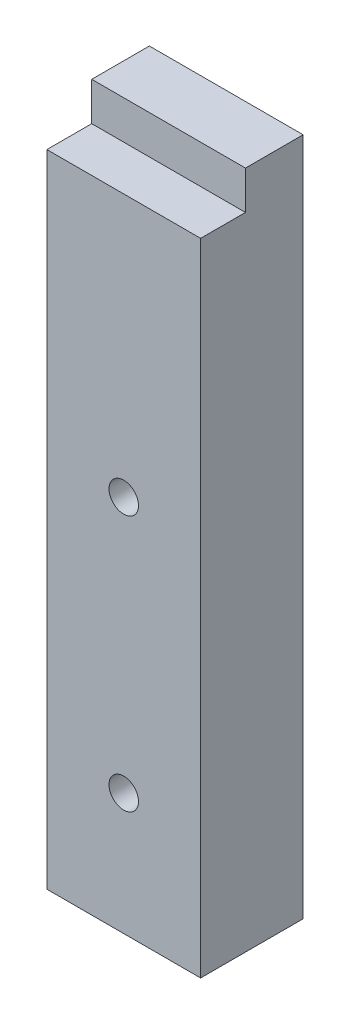
from build123d import *

# Parameters (mm, degrees)
SKETCH1_W           = 12
SKETCH1_H           = 50
SKETCH1_R           = 1.15
BOSS_EXTRUDE1_DEPTH = 8
SKETCH2_W           = 12
SKETCH2_H           = 4.5
BOSS_EXTRUDE2_DEPTH = 3


with BuildPart() as part:
    # Sketch1 → Boss-Extrude1 (new body)
    with BuildSketch(Plane.XY):
        with Locations((6, 25)):
            Rectangle(SKETCH1_W, SKETCH1_H)
        with Locations((6, 29.5)):
            Circle(SKETCH1_R, mode=Mode.SUBTRACT)
        with Locations((6, 9.5)):
            Circle(SKETCH1_R, mode=Mode.SUBTRACT)
    extrude(amount=BOSS_EXTRUDE1_DEPTH)

    # Sketch2 → Boss-Extrude2 (add)
    with BuildSketch(Plane(origin=(0, 50, 0), x_dir=(1, 0, 0), z_dir=(0, 1, 0))):
        with Locations((6, -2.25)):
            Rectangle(SKETCH2_W, SKETCH2_H)
    extrude(amount=BOSS_EXTRUDE2_DEPTH)


solid = part.part
